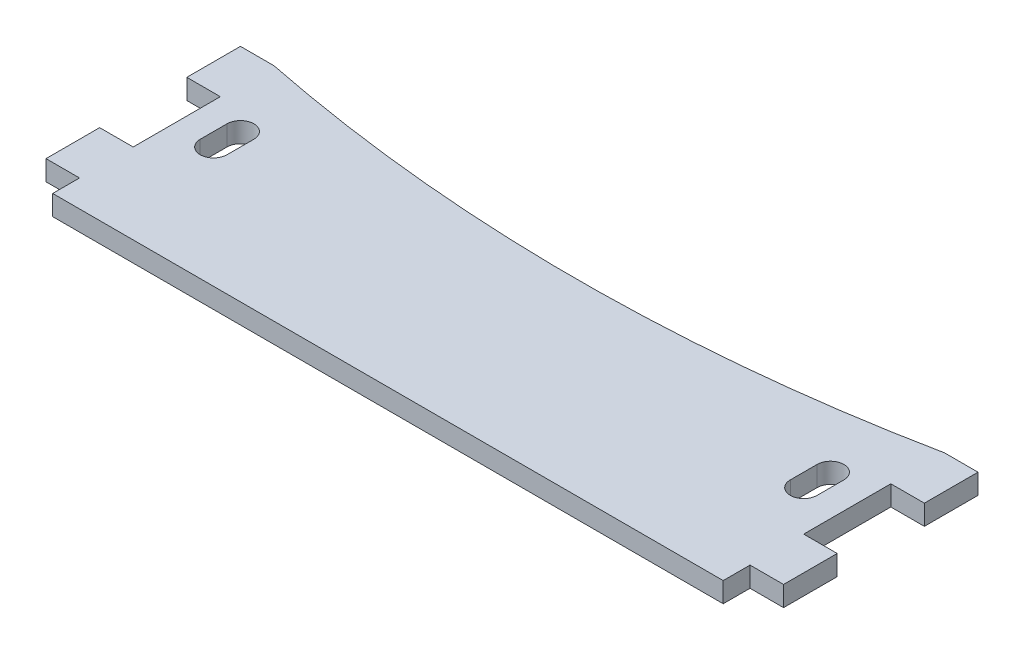
from build123d import *

# Parameters (mm, degrees)
BOSS_EXTRUDE1_DEPTH = 3


with BuildPart() as part:
    # Sketch1 → Boss-Extrude1 (new body)
    with BuildSketch(Plane(origin=(0, 0, 0), x_dir=(1, 0, 0), z_dir=(0, 1, 0))):
        with BuildLine():
            Line((55, 33), (55, 25))
            Line((55, 25), (50, 25))
            Line((50, 25), (50, 12))
            Line((50, 12), (55, 12))
            Line((55, 12), (55, 4))
            Line((55, 4), (50, 4))
            Line((50, 4), (50, 0))
            Line((50, 0), (-50, 0))
            Line((-50, 0), (-50, 4))
            Line((-50, 4), (-55, 4))
            Line((-55, 4), (-55, 12))
            Line((-55, 12), (-50, 12))
            Line((-50, 12), (-50, 25))
            Line((-50, 25), (-55, 25))
            Line((-55, 25), (-55, 33))
            Line((-55, 33), (-50, 33))
            ThreePointArc((-50, 33), (0, 28), (50, 33))
            Line((50, 33), (55, 33))
        make_face()
        with BuildLine():
            Line((46, 22), (46, 18))
            ThreePointArc((46, 18), (44, 16), (42, 18))
            Line((42, 18), (42, 22))
            ThreePointArc((42, 22), (44, 24), (46, 22))
        make_face(mode=Mode.SUBTRACT)
        with BuildLine():
            Line((-42, 22), (-42, 18))
            ThreePointArc((-42, 18), (-44, 16), (-46, 18))
            Line((-46, 18), (-46, 22))
            ThreePointArc((-46, 22), (-44, 24), (-42, 22))
        make_face(mode=Mode.SUBTRACT)
    extrude(amount=BOSS_EXTRUDE1_DEPTH)


solid = part.part
